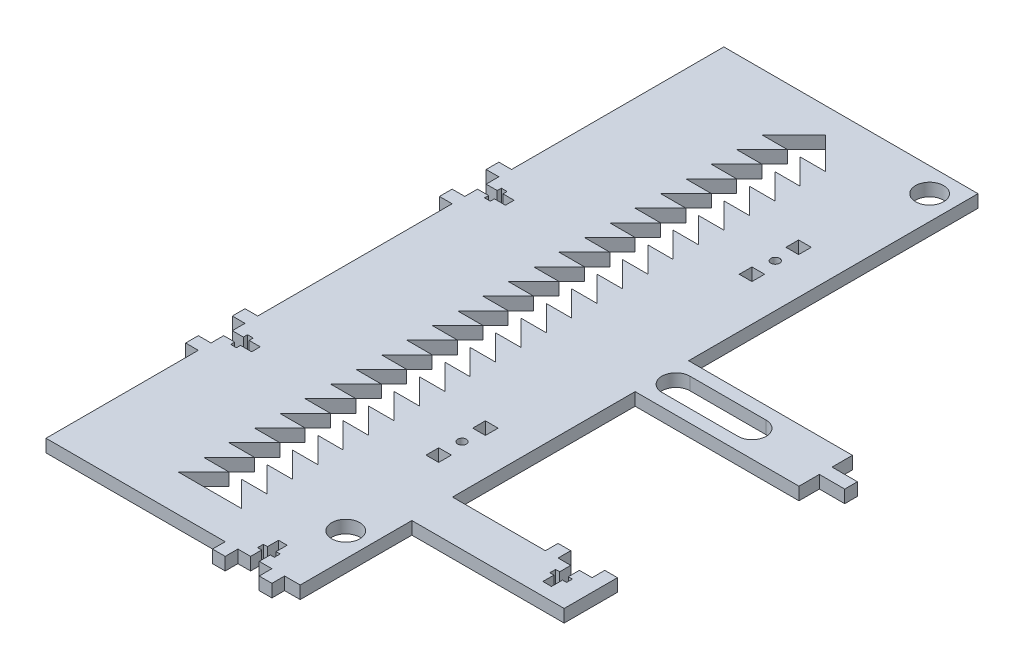
from build123d import *

# Parameters (mm, degrees)
AXLE_SUPPORT_PLATE_W   = 6.35
AXLE_SUPPORT_PLATE_H   = 6.35
AXLE_SUPPORT_PLATE_R   = 2.159
AXLE_SUPPORT_PLATE_R_2 = 7.030128061
BOSS_EXTRUDE1_DEPTH    = 6.35


with BuildPart() as part:
    # Axle Support Plate → Boss-Extrude1 (new body)
    with BuildSketch(Plane(origin=(0, 0, 0), x_dir=(1, 0, 0), z_dir=(0, 1, 0))):
        Polygon((55.79393597, -169.56756403), (63.58606403, -169.56756403), (63.58606403, -113.68756403), (139.78606403, -113.68756403), (139.78606403, -93.36756403), (139.78606403, -87.01756403), (133.43606403, -87.01756403), (133.43606403, -93.36756403), (127.08606403, -93.36756403), (127.08606403, -98.902564009), (129.127064012, -98.902564009), (129.127064012, -101.802564051), (127.08606403, -101.802564051), (127.08606403, -107.33756403), (122.76806403, -107.33756403), (122.76806403, -101.802564051), (120.727064048, -101.802564051), (120.727064048, -98.902564009), (122.76806403, -98.902564009), (122.76806403, -93.36756403), (116.41806403, -93.36756403), (116.41806403, -87.01756403), (110.06806403, -87.01756403), (110.06806403, -93.36756403), (63.58606403, -93.36756403), (63.58606403, -1.972692091), (145.546192091, -1.972692091), (145.546192091, 8.23243597), (158.246192091, 8.23243597), (158.246192091, 14.58243597), (145.546192091, 14.58243597), (145.546192091, 24.78756403), (63.58606403, 24.78756403), (63.58606403, 169.56756403), (-63.58606403, 169.56756403), (-63.58606403, 63.35043597), (-69.93606403, 63.35043597), (-69.93606403, 57.00043597), (-63.58606403, 57.00043597), (-63.58606403, 50.65043597), (-58.051064051, 50.65043597), (-58.051064051, 52.691435952), (-55.151064009, 52.691435952), (-55.151064009, 50.65043597), (-49.61606403, 50.65043597), (-49.61606403, 46.33243597), (-55.151064009, 46.33243597), (-55.151064009, 44.291435988), (-58.051064051, 44.291435988), (-58.051064051, 46.33243597), (-63.58606403, 46.33243597), (-63.58606403, 39.98243597), (-69.93606403, 39.98243597), (-69.93606403, 33.63243597), (-63.58606403, 33.63243597), (-63.58606403, -63.64956403), (-69.93606403, -63.64956403), (-69.93606403, -69.99956403), (-63.58606403, -69.99956403), (-63.58606403, -76.34956403), (-58.051064051, -76.34956403), (-58.051064051, -74.308564048), (-55.151064009, -74.308564048), (-55.151064009, -76.34956403), (-49.61606403, -76.34956403), (-49.61606403, -80.66756403), (-55.151064009, -80.66756403), (-55.151064009, -82.708564012), (-58.051064051, -82.708564012), (-58.051064051, -80.66756403), (-63.58606403, -80.66756403), (-63.58606403, -87.01756403), (-69.93606403, -87.01756403), (-69.93606403, -93.36756403), (-63.58606403, -93.36756403), (-63.58606403, -169.56756403), (26.07593597, -169.56756403), (26.07593597, -175.91756403), (32.42593597, -175.91756403), (32.42593597, -169.56756403), (38.77593597, -169.56756403), (38.77593597, -164.032564051), (36.734935988, -164.032564051), (36.734935988, -161.132564009), (38.77593597, -161.132564009), (38.77593597, -155.59756403), (43.09393597, -155.59756403), (43.09393597, -161.132564009), (45.134935952, -161.132564009), (45.134935952, -164.032564051), (43.09393597, -164.032564051), (43.09393597, -169.56756403), (49.44393597, -169.56756403), (49.44393597, -175.91756403), (55.79393597, -175.91756403), align=None)
        with Locations((41.95093597, -78.63556403)):
            Rectangle(AXLE_SUPPORT_PLATE_W, AXLE_SUPPORT_PLATE_H, mode=Mode.SUBTRACT)
        with Locations((41.95093597, -66.95156403)):
            Circle(AXLE_SUPPORT_PLATE_R, mode=Mode.SUBTRACT)
        with Locations((41.95093597, -55.26756403)):
            Rectangle(AXLE_SUPPORT_PLATE_W, AXLE_SUPPORT_PLATE_H, mode=Mode.SUBTRACT)
        with Locations((51.47593597, -134.64256403)):
            Circle(AXLE_SUPPORT_PLATE_R_2, mode=Mode.SUBTRACT)
        Polygon((-15.875, 140.99256403), (0, 156.86756403), (15.875, 140.99256403), (3.175, 140.99256403), (15.875, 128.29256403), (3.175, 128.29256403), (15.875, 115.59256403), (3.175, 115.59256403), (15.875, 102.89256403), (3.175, 102.89256403), (15.875, 90.19256403), (3.175, 90.19256403), (15.875, 77.49256403), (3.175, 77.49256403), (15.875, 64.79256403), (3.175, 64.79256403), (15.875, 52.09256403), (3.175, 52.09256403), (15.875, 39.39256403), (3.175, 39.39256403), (15.875, 26.69256403), (3.175, 26.69256403), (15.875, 13.99256403), (3.175, 13.99256403), (15.875, 1.29256403), (3.175, 1.29256403), (15.875, -11.40743597), (3.175, -11.40743597), (15.875, -24.10743597), (3.175, -24.10743597), (15.875, -36.80743597), (3.175, -36.80743597), (15.875, -49.50743597), (3.175, -49.50743597), (15.875, -62.20743597), (3.175, -62.20743597), (15.875, -74.90743597), (3.175, -74.90743597), (15.875, -87.60743597), (3.175, -87.60743597), (15.875, -100.30743597), (3.175, -100.30743597), (15.875, -113.00743597), (3.175, -113.00743597), (15.875, -125.70743597), (3.175, -125.70743597), (15.875, -138.40743597), (3.175, -138.40743597), (15.875, -151.10743597), (-15.875, -151.10743597), (-3.175, -138.40743597), (-15.875, -138.40743597), (-3.175, -125.70743597), (-15.875, -125.70743597), (-3.175, -113.00743597), (-15.875, -113.00743597), (-3.175, -100.30743597), (-15.875, -100.30743597), (-3.175, -87.60743597), (-15.875, -87.60743597), (-3.175, -74.90743597), (-15.875, -74.90743597), (-3.175, -62.20743597), (-15.875, -62.20743597), (-3.175, -49.50743597), (-15.875, -49.50743597), (-3.175, -36.80743597), (-15.875, -36.80743597), (-3.175, -24.10743597), (-15.875, -24.10743597), (-3.175, -11.40743597), (-15.875, -11.40743597), (-3.175, 1.29256403), (-15.875, 1.29256403), (-3.175, 13.99256403), (-15.875, 13.99256403), (-3.175, 26.69256403), (-15.875, 26.69256403), (-3.175, 39.39256403), (-15.875, 39.39256403), (-3.175, 52.09256403), (-15.875, 52.09256403), (-3.175, 64.79256403), (-15.875, 64.79256403), (-3.175, 77.49256403), (-15.875, 77.49256403), (-3.175, 90.19256403), (-15.875, 90.19256403), (-3.175, 102.89256403), (-15.875, 102.89256403), (-3.175, 115.59256403), (-15.875, 115.59256403), (-3.175, 128.29256403), (-15.875, 128.29256403), (-3.175, 140.99256403), align=None, mode=Mode.SUBTRACT)
        with Locations((41.95093597, 78.08243597)):
            Rectangle(AXLE_SUPPORT_PLATE_W, AXLE_SUPPORT_PLATE_H, mode=Mode.SUBTRACT)
        with Locations((41.95093597, 89.76643597)):
            Circle(AXLE_SUPPORT_PLATE_R, mode=Mode.SUBTRACT)
        with Locations((41.95093597, 101.45043597)):
            Rectangle(AXLE_SUPPORT_PLATE_W, AXLE_SUPPORT_PLATE_H, mode=Mode.SUBTRACT)
        with BuildLine():
            ThreePointArc((70.616192091, 4.377307909), (63.58606403, 11.40743597), (70.616192091, 18.43756403))
            Line((70.616192091, 18.43756403), (108.716192091, 18.43756403))
            ThreePointArc((108.716192091, 18.43756403), (115.746320151, 11.40743597), (108.716192091, 4.377307909))
            Line((108.716192091, 4.377307909), (70.616192091, 4.377307909))
        make_face(mode=Mode.SUBTRACT)
        with Locations((51.47593597, 157.45743597)):
            Circle(AXLE_SUPPORT_PLATE_R_2, mode=Mode.SUBTRACT)
    extrude(amount=BOSS_EXTRUDE1_DEPTH)


solid = part.part
